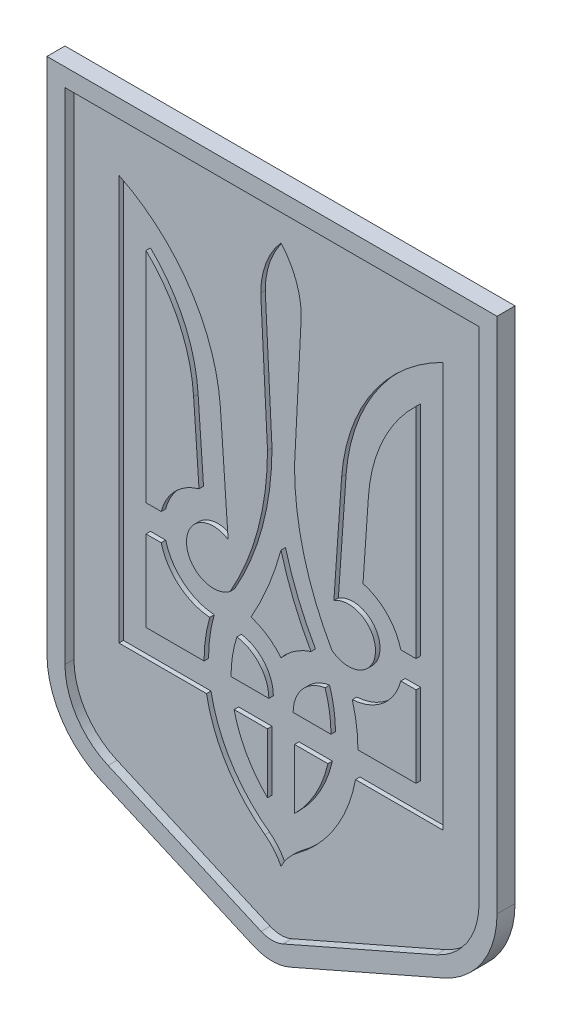
from build123d import *

# Parameters (mm, degrees)
EXTRUDE_1_DEPTH = 2
EXTRUDE_2_DEPTH = 2
OTHER_START     = 1
OTHER_1_DEPTH   = 1


# Read off the part's stored shape, not the designer's step: Полость1
with BuildPart() as part:
    # Эскиз1 → Бобышка-Вытянуть1 (new body)
    with BuildSketch(Plane.XY):
        with BuildLine():
            Line((-4.017219652, 1.762254744), (-38.034439304, 16.684766311))
            ThreePointArc((-38.034439304, 16.684766311), (-46.743488079, 24.061279464), (-50, 35))
            Line((-50, 35), (-50, 150))
            Line((-50, 150), (50, 150))
            Line((50, 150), (50, 35))
            ThreePointArc((50, 35), (46.743488079, 24.061279464), (38.034439304, 16.684766311))
            Line((38.034439304, 16.684766311), (4.017219652, 1.762254744))
            ThreePointArc((4.017219652, 1.762254744), (0, 0.919871589), (-4.017219652, 1.762254744))
        make_face()
    extrude(amount=EXTRUDE_1_DEPTH)

    # Эскиз2 → Бобышка-Вытянуть2 (add)
    with BuildSketch(Plane.XY.offset(2)):
        with BuildLine():
            Line((50, 150), (-50, 150))
            Line((-50, 150), (-50, 35))
            ThreePointArc((-50, 35), (-46.743488079, 24.061279464), (-38.034439304, 16.684766311))
            Line((-38.034439304, 16.684766311), (-4.017219652, 1.762254744))
            ThreePointArc((-4.017219652, 1.762254744), (0, 0.919871589), (4.017219652, 1.762254744))
            Line((4.017219652, 1.762254744), (38.034439304, 16.684766311))
            ThreePointArc((38.034439304, 16.684766311), (46.743488079, 24.061279464), (50, 35))
            Line((50, 35), (50, 150))
        make_face()
        with BuildLine():
            Line((46, 146), (-46, 146))
            Line((-46, 146), (-46, 35))
            ThreePointArc((-46, 35), (-43.394790463, 26.249023571), (-36.427551443, 20.347813049))
            Line((-36.427551443, 20.347813049), (-2.410331791, 5.425301482))
            ThreePointArc((-2.410331791, 5.425301482), (0, 4.919871589), (2.410331791, 5.425301482))
            Line((2.410331791, 5.425301482), (36.427551443, 20.347813049))
            ThreePointArc((36.427551443, 20.347813049), (43.394790463, 26.249023571), (46, 35))
            Line((46, 35), (46, 146))
        make_face(mode=Mode.SUBTRACT)
    extrude(amount=EXTRUDE_2_DEPTH)

    # Полость1 outline → Полость1 (cut)
    with BuildSketch(Plane.XY.offset(OTHER_START)):
        with BuildLine():
            ThreePointArc((11.745635367, 75.156774095), (20.994280281, 69.854105541), (11.31836185, 65.378356547))
            ThreePointArc((11.31836185, 65.378356547), (5.115095453, 80.478737769), (3, 96.666029027))
            Line((3, 96.666029027), (4.5, 126.216029027))
            ThreePointArc((4.5, 126.216029027), (3.337458241, 132.579990058), (0, 138.121909927))
            ThreePointArc((0, 138.121909927), (-3.33745824, 132.579990058), (-4.5, 126.216029027))
            Line((-4.5, 126.216029027), (-3, 96.666029027))
            ThreePointArc((-3, 96.666029027), (-5.115095453, 80.478737769), (-11.31836185, 65.378356547))
            ThreePointArc((-11.31836185, 65.378356547), (-20.994280281, 69.854105541), (-11.745635367, 75.156774095))
            Line((-11.745635367, 75.156774095), (-13.469683479, 99.811810763))
            ThreePointArc((-13.469683479, 99.811810763), (-20.328911117, 119.444533663), (-36, 133.116029027))
            Line((-36, 133.116029027), (-36, 43.116029027))
            Line((-36, 43.116029027), (-16.549961479, 43.116029027))
            ThreePointArc((-16.549961479, 43.116029027), (-12.036010614, 31.549603352), (-3.567460781, 22.469866625))
            ThreePointArc((-3.567460781, 22.469866625), (-1.525407448, 20.507840011), (0, 18.121909927))
            ThreePointArc((0, 18.121909927), (1.525407448, 20.507840011), (3.567460781, 22.469866625))
            ThreePointArc((3.567460781, 22.469866625), (12.036010614, 31.549603352), (16.549961479, 43.116029027))
            Line((16.549961479, 43.116029027), (36, 43.116029027))
            Line((36, 43.116029027), (36, 133.116029027))
            ThreePointArc((36, 133.116029027), (20.328911117, 119.444533663), (13.469683479, 99.811810763))
            Line((13.469683479, 99.811810763), (11.745635367, 75.156774095))
        make_face()
        with BuildLine():
            ThreePointArc((-3, 29.83417227), (-7.667449376, 35.941229982), (-10.424893162, 43.116029027))
            Line((-10.424893162, 43.116029027), (-3, 43.116029027))
            Line((-3, 43.116029027), (-3, 29.83417227))
        make_face(mode=Mode.SUBTRACT)
        with BuildLine():
            ThreePointArc((-15.840643779, 58.145510324), (-16.78364457, 53.674469292), (-17.1, 49.116029027))
            Line((-17.1, 49.116029027), (-30, 49.116029027))
            Line((-30, 49.116029027), (-30, 67.116029027))
            Line((-30, 67.116029027), (-26.618950039, 67.116029027))
            ThreePointArc((-26.618950039, 67.116029027), (-22.676452369, 60.892576365), (-15.840643779, 58.145510324))
        make_face(mode=Mode.SUBTRACT)
        with BuildLine():
            ThreePointArc((-9.793333333, 57.413777048), (-4.715017619, 54.57423386), (-2.7, 49.116029027))
            Line((-2.7, 49.116029027), (-11.1, 49.116029027))
            ThreePointArc((-11.1, 49.116029027), (-10.771332925, 53.316029027), (-9.793333333, 57.413777048))
        make_face(mode=Mode.SUBTRACT)
        with BuildLine():
            Line((3, 29.83417227), (3, 43.116029027))
            Line((3, 43.116029027), (10.424893162, 43.116029027))
            ThreePointArc((10.424893162, 43.116029027), (7.667449376, 35.941229982), (3, 29.83417227))
        make_face(mode=Mode.SUBTRACT)
        with BuildLine():
            ThreePointArc((2.7, 49.116029027), (4.715017619, 54.57423386), (9.793333333, 57.413777048))
            ThreePointArc((9.793333333, 57.413777048), (10.771332925, 53.316029027), (11.1, 49.116029027))
            Line((11.1, 49.116029027), (2.7, 49.116029027))
        make_face(mode=Mode.SUBTRACT)
        with BuildLine():
            ThreePointArc((0, 79.005460407), (2.806605948, 70.695071551), (6.654810678, 62.812754617))
            ThreePointArc((6.654810678, 62.812754617), (3.005032266, 61.025332003), (0, 58.289359938))
            ThreePointArc((0, 58.289359938), (-3.005032266, 61.025332003), (-6.654810678, 62.812754617))
            ThreePointArc((-6.654810678, 62.812754617), (-2.806605948, 70.695071551), (0, 79.005460407))
        make_face(mode=Mode.SUBTRACT)
        with BuildLine():
            ThreePointArc((17.1, 49.116029027), (16.78364457, 53.674469292), (15.840643779, 58.145510324))
            ThreePointArc((15.840643779, 58.145510324), (22.676452369, 60.892576365), (26.618950039, 67.116029027))
            Line((26.618950039, 67.116029027), (30, 67.116029027))
            Line((30, 67.116029027), (30, 49.116029027))
            Line((30, 49.116029027), (17.1, 49.116029027))
        make_face(mode=Mode.SUBTRACT)
        with BuildLine():
            ThreePointArc((-18.216224905, 81.676993406), (-23.564060467, 78.521793021), (-26.618950039, 73.116029027))
            Line((-26.618950039, 73.116029027), (-30, 73.116029027))
            Line((-30, 73.116029027), (-30, 121.661547275))
            ThreePointArc((-30, 121.661547275), (-22.554855421, 111.225521288), (-19.413361995, 98.796851397))
            Line((-19.413361995, 98.796851397), (-18.216224905, 81.676993406))
        make_face(mode=Mode.SUBTRACT)
        with BuildLine():
            ThreePointArc((19.413361995, 98.796851397), (22.554855421, 111.225521288), (30, 121.661547275))
            Line((30, 121.661547275), (30, 73.116029027))
            Line((30, 73.116029027), (26.618950039, 73.116029027))
            ThreePointArc((26.618950039, 73.116029027), (23.564060467, 78.521793021), (18.216224905, 81.676993406))
            Line((18.216224905, 81.676993406), (19.413361995, 98.796851397))
        make_face(mode=Mode.SUBTRACT)
    extrude(amount=OTHER_1_DEPTH, mode=Mode.SUBTRACT)


solid = part.part
